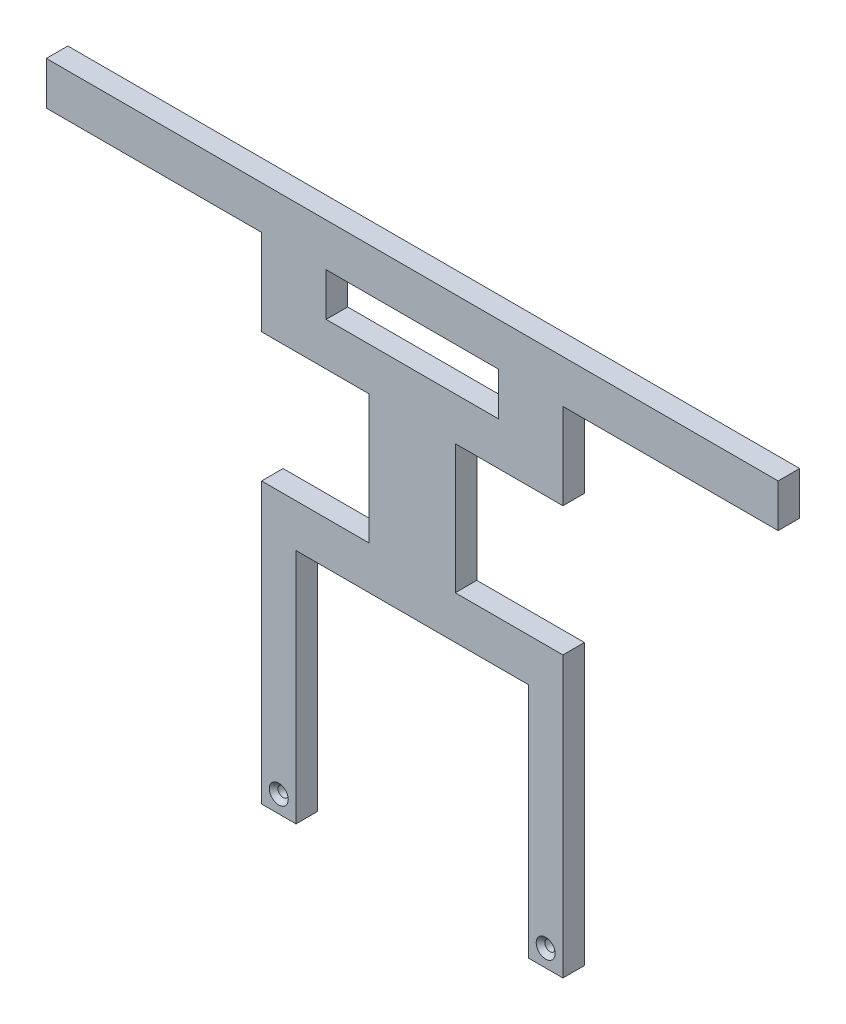
from build123d import *

# Parameters (mm, degrees)
BOSS_EXTRU_1_DEPTH                             = 5
FRAISAGE_POUR_VIS_T_TE_FRAIS_E_M21_D           = 2.4
FRAISAGE_POUR_VIS_T_TE_FRAIS_E_M21_CSINK_D     = 4.4
FRAISAGE_POUR_VIS_T_TE_FRAIS_E_M21_CSINK_ANGLE = 90


with BuildPart() as part:
    # Esquisse1 → Boss.-Extru.1 (new body)
    with BuildSketch(Plane.XY):
        Polygon((0, 0), (0, 65), (25, 65), (25, 95), (0, 95), (0, 115), (-50, 115), (-50, 125), (35, 125), (35, 115), (15, 115), (15, 105), (35, 105), (35, 55), (8, 55), (8, 0), align=None)
    boss_extru_1 = extrude(amount=BOSS_EXTRU_1_DEPTH)

    # Symétrie1: Boss.-Extru.1 across plane
    add(boss_extru_1.mirror(Plane(origin=(35, 105, 5), x_dir=(0, 0, 1), z_dir=(-1, 0, 0))))

    # Fraisage pour vis à tête fraisée M21 (through all)
    with Locations(Plane.XY.offset(5)):
        with Locations((4, 4), (66, 4)):
            CounterSinkHole(FRAISAGE_POUR_VIS_T_TE_FRAIS_E_M21_D / 2, FRAISAGE_POUR_VIS_T_TE_FRAIS_E_M21_CSINK_D / 2, counter_sink_angle=FRAISAGE_POUR_VIS_T_TE_FRAIS_E_M21_CSINK_ANGLE)


solid = part.part
